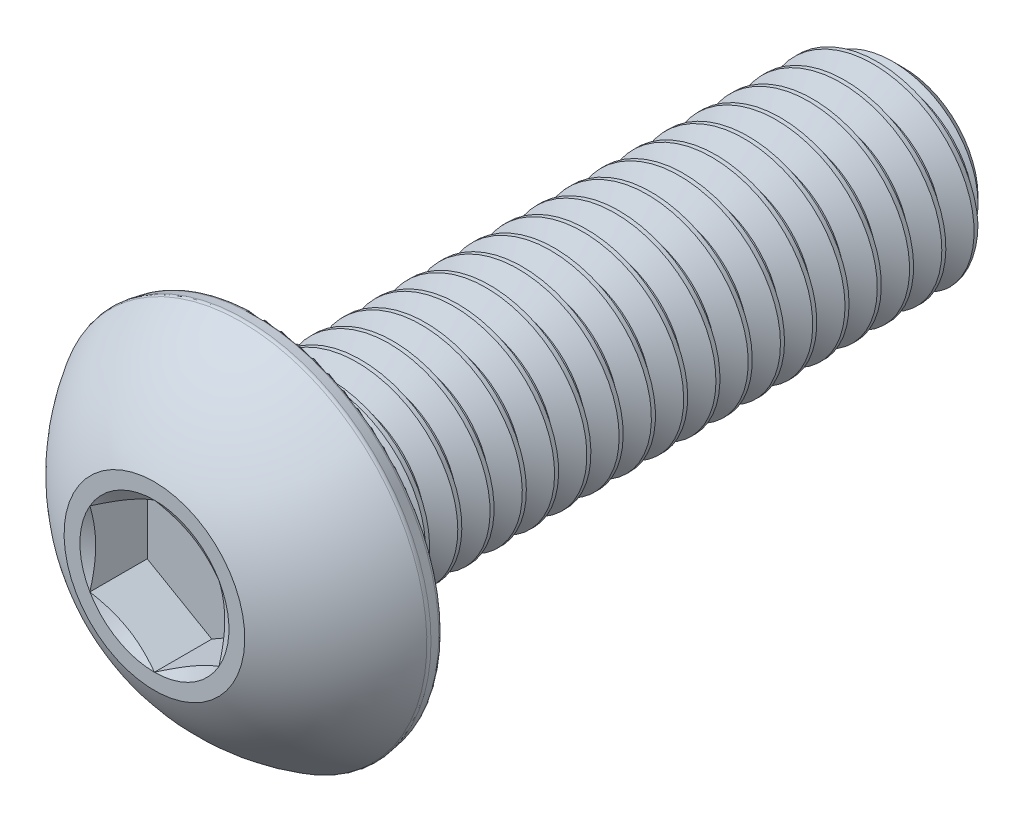
from build123d import *

# Parameters (mm, degrees)
CUT_EXTRUDE1_DEPTH = 1.41097
FILLET1_R          = 0.12827
CUT_SWEEP1_PITCH   = 0.79375
CUT_SWEEP1_TO      = 15.875


with BuildPart() as part:
    # Sketch3 → Revolve1 (revolve)
    with BuildSketch(Plane(origin=(0, 0, 0), x_dir=(0, 0, -1), z_dir=(1, 0, 0)), mode=Mode.PRIVATE) as revolve1_sk:
        with BuildLine():
            Line((-9.2202, 0), (-9.2202, 2.2225))
            ThreePointArc((-9.2202, 2.2225), (-8.31446038, 3.573966445), (-7.03961, 4.5847))
            Line((-7.03961, 4.5847), (-6.6548, 4.516847615))
            Line((-6.6548, 4.516847615), (-6.6548, 2.413))
            Line((-6.6548, 2.413), (8.6248875, 2.413))
            Line((8.6248875, 2.413), (9.2202, 1.8176875))
            Line((9.2202, 1.8176875), (9.2202, 0))
            Line((9.2202, 0), (-9.2202, 0))
        make_face()
    revolve(revolve1_sk.sketch.rotate(Axis((0, 0, 9.2202), (0, 0, -1)), 90), axis=Axis((0, 0, 9.2202), (0, 0, -1)))

    # Sketch4 → Cut-Extrude1 (cut)
    with BuildSketch(Plane.XY.offset(9.2202)):
        Polygon((-1.5875, -0.916543552), (0, -1.833087105), (1.5875, -0.916543552), (1.5875, 0.916543552), (0, 1.833087105), (-1.5875, 0.916543552), align=None)
    extrude(amount=-CUT_EXTRUDE1_DEPTH, mode=Mode.SUBTRACT)

    # Cut-Extrude2 cone 1 section (through the dimple's axis) → Cut-Extrude2 (revolve, cut)
    with BuildSketch(Plane(origin=(0, 0, 9.2202), x_dir=(0, -1, 0), z_dir=(1, 0, 0))):
        Polygon((0, 0), (1.833087105, 0), (0, 1.058333333), align=None)
    revolve(axis=Axis((0, 0, 9.2202), (0, 0, -1)), mode=Mode.SUBTRACT)

    # Fillet1
    fillet1_edges = [part.edges().sort_by_distance(p)[0] for p in [
        (-4.516847615, 0, 6.6548),
        (-4.5847, 0, 7.03961),
    ]]
    fillet(fillet1_edges, radius=FILLET1_R)


with BuildPart() as body_2:
    # Split1: read off the stored shape, not the designer's step
    # Split1: the piece on the far side of the plane
    add(part.part)
    split(bisect_by=Plane.XY.offset(6.6548), keep=Keep.BOTTOM)

    # Cut-Sweep1: arcs per turn and ends read off the stored shape
    # Cut-Sweep1: the profile of Sketch7 screwed along a right-hand helix through 21 turns, 8 arcs to a turn; built about Z, then put on its axis
    cut_sweep1_z = Axis((0, 0, 0), (0, 0, 1))
    cut_sweep1_corners = [(2.455962979, 0, 0.024804688), (2.455962979, 0, -0.719335937), (1.897444252, 0, -0.396875), (1.897444252, 0, -0.29765625)]
    with BuildLine(mode=Mode.PRIVATE) as cut_sweep1_profile:
        Line(cut_sweep1_corners[0], cut_sweep1_corners[1])
        Line(cut_sweep1_corners[1], cut_sweep1_corners[2])
        Line(cut_sweep1_corners[2], cut_sweep1_corners[3])
        Line(cut_sweep1_corners[3], cut_sweep1_corners[0])
    cut_sweep1_cap = Face(cut_sweep1_profile.wire())
    cut_sweep1_turn_angles = [0, 22.5, 45, 67.5, 90, 112.5, 135, 157.5, 180, 202.5, 225, 247.5, 270, 292.5, 315, 337.5, 360]
    cut_sweep1_turn_weights = [1, 0.9238795325112867, 1, 0.9238795325112867, 1, 0.9238795325112867, 1, 0.9238795325112867, 1, 0.9238795325112867, 1, 0.9238795325112867, 1, 0.9238795325112867, 1, 0.9238795325112867, 1]
    cut_sweep1_turn_rails = [Edge.make_bspline([Vector(p[0], p[1], 0).rotate(cut_sweep1_z, cut_sweep1_turn_angles[k]) / cut_sweep1_turn_weights[k] + Vector(0, 0, p[2] + CUT_SWEEP1_PITCH * cut_sweep1_turn_angles[k] / 360) for k in range(17)], [0, 0, 0, 1, 1, 2, 2, 3, 3, 4, 4, 5, 5, 6, 6, 7, 7, 8, 8, 8], 2, cut_sweep1_turn_weights) for p in cut_sweep1_corners]
    cut_sweep1_turn_sides = [Face.make_surface_from_curves(cut_sweep1_turn_rails[p[0]], cut_sweep1_turn_rails[p[1]]) for p in [(0, 1), (1, 2), (2, 3), (3, 0)]]
    cut_sweep1 = Plane(origin=(0, 0, -9.2202), x_dir=(0, 1, 0), z_dir=(0, 0, 1)) * split(Solid(Shell([*[p.moved(Location((0, 0, CUT_SWEEP1_PITCH * i))) for i in range(21) for p in cut_sweep1_turn_sides], cut_sweep1_cap, cut_sweep1_cap.rotate(cut_sweep1_z, 7560).moved(Location((0, 0, CUT_SWEEP1_PITCH * 7560 / 360)))])), bisect_by=Plane.XY.offset(CUT_SWEEP1_TO), keep=Keep.BOTTOM, mode=Mode.PRIVATE)
    add(cut_sweep1, mode=Mode.SUBTRACT)


with BuildPart() as part_1:
    add(part.part)

    # Split1
    split(bisect_by=Plane.XY.offset(6.6548), keep=Keep.TOP)

    add(body_2.part)  # Boss-Extrude1 merges body 2
    # Boss-Extrude1: read off the stored shape, not the designer's step
    # Boss-Extrude1 outline → Boss-Extrude1 (revolve)
    with BuildSketch(Plane.XZ):
        Polygon((1.897438552, 6.6548), (1.897438552, 6.053312594), (2.498925958, 6.6548), align=None)
    revolve(axis=Axis((0, 0, 0), (0, 0, 1)))


solid = part_1.part
